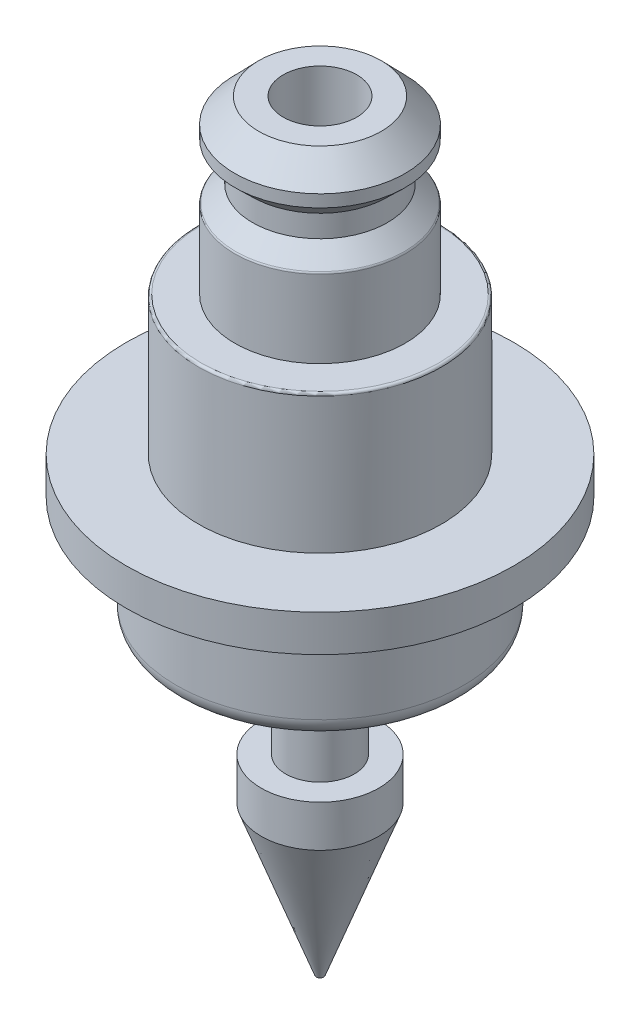
from build123d import *

# Parameters (mm, degrees)
GREEN_BASE_FILLET_R = 0.75
METAL_TOP_FILLETS_R = 0.1


with BuildPart() as part:
    # Body Sketch → Body Revolve (revolve)
    with BuildSketch(Plane.XY):
        Polygon((1.5, 14.15), (2.5, 14.15), (3.475, 13.15), (3.475, 12.65), (2.75, 11.95), (2.75, 11.05), (3.475, 10.35), (3.475, 7.15), (4.955, 7.15), (4.955, 1.5), (7.9, 1.5), (7.9, 0), (5.85, 0), (5.85, -4.5), (1.4, -4.5), (1.4, -9.1), (2.4, -9.1), (2.4, -10.8), (0.15, -16.9), (0.15, 0), (1.5, 0), align=None)
    revolve(axis=Axis((0, 0, 0), (0, 1, 0)))

    # Green Base Fillet
    green_base_fillet_edges = [part.edges().sort_by_distance(p)[0] for p in [
        (-5.85, -4.5, 0),
    ]]
    fillet(green_base_fillet_edges, radius=GREEN_BASE_FILLET_R)

    # Metal Top Fillets
    metal_top_fillets_edges = [part.edges().sort_by_distance(p)[0] for p in [
        (-3.475, 10.35, 0),
        (-4.955, 7.15, 0),
    ]]
    fillet(metal_top_fillets_edges, radius=METAL_TOP_FILLETS_R)


solid = part.part
